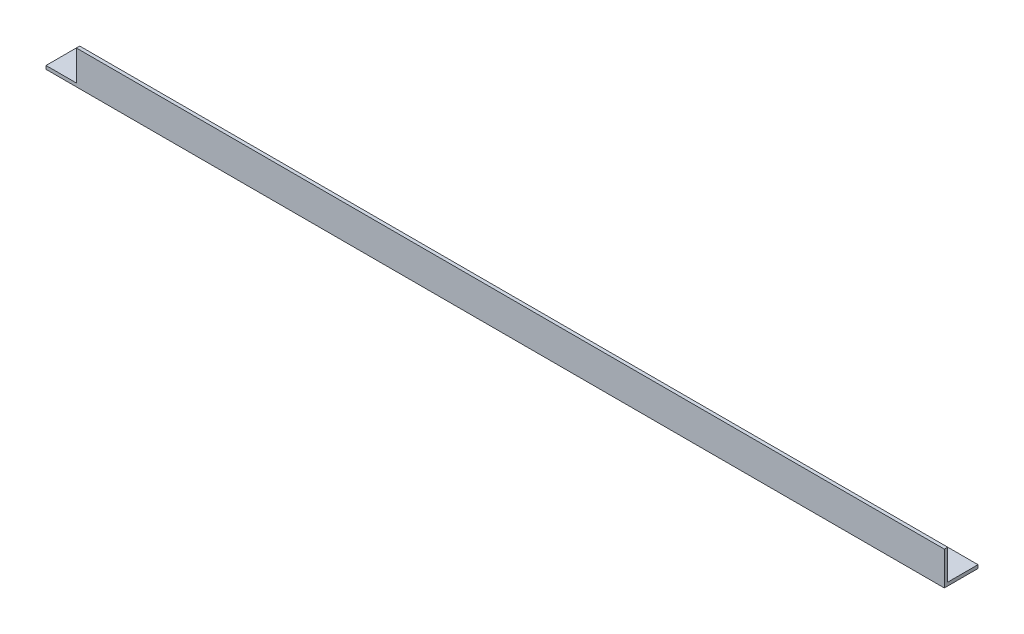
from build123d import *

# Parameters (mm, degrees)
EXTRUDE_1_DEPTH     = 800
SKETCH_2_W          = 27
SKETCH_2_H          = 27
CUT_EXTRUDE_1_DEPTH = 802.124210095


with BuildPart() as part:
    # Эскиз1 → Вытянуть-Тонкостенный1 (new body)
    with BuildSketch(Plane(origin=(0, 0, 0), x_dir=(0, 0, -1), z_dir=(1, 0, 0))):
        Polygon((0, 30), (0, 0), (30, 0), (30, 3), (3, 3), (3, 30), align=None)
    extrude(amount=EXTRUDE_1_DEPTH)

    # Эскиз2 → Вырез-Вытянуть1 (cut, through all)
    with BuildSketch(Plane.XY):
        with Locations((13.5, 16.5)):
            Rectangle(SKETCH_2_W, SKETCH_2_H)
    extrude(amount=-CUT_EXTRUDE_1_DEPTH, mode=Mode.SUBTRACT)


solid = part.part
